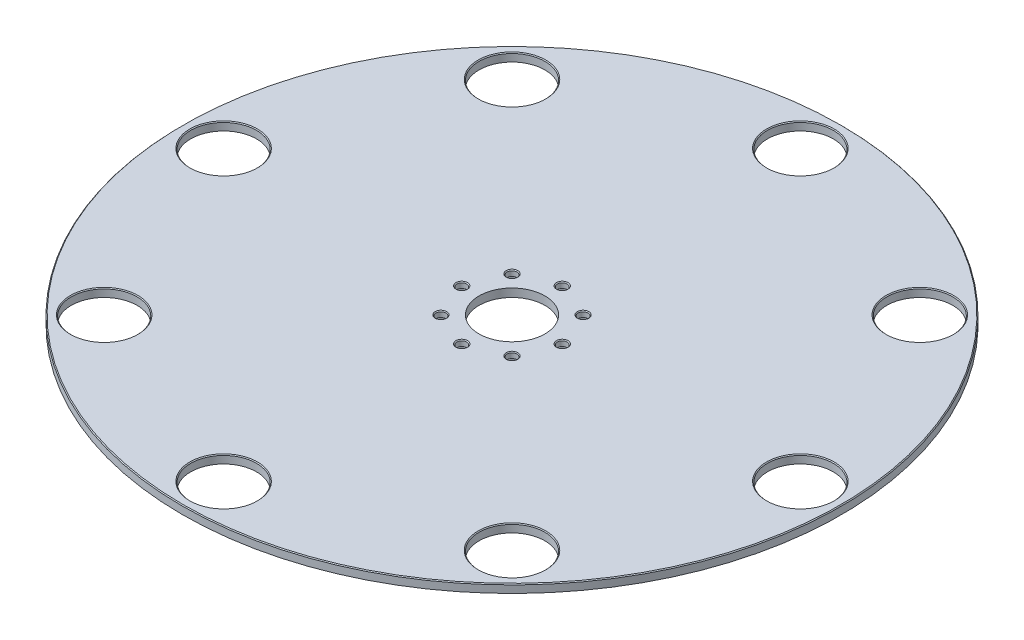
from build123d import *

# Parameters (mm, degrees)
SKETCH2_R            = 400
SKETCH2_R_2          = 40
BOSS_EXTRUDE10_DEPTH = 10
CHAMFER1_SIZE        = 1
SKETCH13_R           = 6
CUT_EXTRUDE1_DEPTH   = 7
CHAMFER2_SIZE        = 1
SKETCH14_R           = 4
CUT_EXTRUDE2_DEPTH   = 3


with BuildPart() as part:
    # Sketch2 → Boss-Extrude10 (new body)
    with BuildSketch(Plane(origin=(0, 0, 0), x_dir=(1, 0, 0), z_dir=(0, 1, 0))):
        Circle(SKETCH2_R)
        Circle(SKETCH2_R_2, mode=Mode.SUBTRACT)
        with Locations((0, 350)):
            Circle(SKETCH2_R_2, mode=Mode.SUBTRACT)
        with Locations((247.487373415, 247.487373415)):
            Circle(SKETCH2_R_2, mode=Mode.SUBTRACT)
        with Locations((350, 0)):
            Circle(SKETCH2_R_2, mode=Mode.SUBTRACT)
        with Locations((247.487373415, -247.487373415)):
            Circle(SKETCH2_R_2, mode=Mode.SUBTRACT)
        with Locations((0, -350)):
            Circle(SKETCH2_R_2, mode=Mode.SUBTRACT)
        with Locations((-247.487373415, -247.487373415)):
            Circle(SKETCH2_R_2, mode=Mode.SUBTRACT)
        with Locations((-350, 0)):
            Circle(SKETCH2_R_2, mode=Mode.SUBTRACT)
        with Locations((-247.487373415, 247.487373415)):
            Circle(SKETCH2_R_2, mode=Mode.SUBTRACT)
    extrude(amount=BOSS_EXTRUDE10_DEPTH)

    # Chamfer1
    chamfer1_edges = [part.edges().sort_by_distance(p)[0] for p in [
        (-287.487373415, 10, 247.487373415),
        (-40, 10, 350),
        (207.487373415, 10, 247.487373415),
        (310, 10, 0),
        (207.487373415, 10, -247.487373415),
        (-40, 10, -350),
        (-287.487373415, 10, -247.487373415),
        (-390, 10, 0),
        (-400, 10, 0),
    ]]
    chamfer(chamfer1_edges, length=CHAMFER1_SIZE)

    # Sketch13 → Cut-Extrude1 (cut)
    with BuildSketch(Plane(origin=(0, 10, 0), x_dir=(1, 0, 0), z_dir=(0, 1, 0))):
        with Locations((-61, 0)):
            Circle(SKETCH13_R)
        with Locations((-43.133513652, 43.133513652)):
            Circle(SKETCH13_R)
        with Locations((0, 61)):
            Circle(SKETCH13_R)
        with Locations((43.133513652, 43.133513652)):
            Circle(SKETCH13_R)
        with Locations((61, 0)):
            Circle(SKETCH13_R)
        with Locations((43.133513652, -43.133513652)):
            Circle(SKETCH13_R)
        with Locations((0, -61)):
            Circle(SKETCH13_R)
        with Locations((-43.133513652, -43.133513652)):
            Circle(SKETCH13_R)
    extrude(amount=-CUT_EXTRUDE1_DEPTH, mode=Mode.SUBTRACT)

    # Chamfer2
    chamfer2_edges = [part.edges().sort_by_distance(p)[0] for p in [
        (-6, 10, 61),
        (37.133513652, 10, 43.133513652),
        (55, 10, 0),
        (37.133513652, 10, -43.133513652),
        (-6, 10, -61),
        (-49.133513652, 10, -43.133513652),
        (-67, 10, 0),
        (-49.133513652, 10, 43.133513652),
    ]]
    chamfer(chamfer2_edges, length=CHAMFER2_SIZE)

    # Sketch14 → Cut-Extrude2 (cut)
    with BuildSketch(Plane.XZ):
        with Locations((-61, 0)):
            Circle(SKETCH14_R)
        with Locations((-43.133513652, 43.133513652)):
            Circle(SKETCH14_R)
        with Locations((0, 61)):
            Circle(SKETCH14_R)
        with Locations((43.133513652, 43.133513652)):
            Circle(SKETCH14_R)
        with Locations((61, 0)):
            Circle(SKETCH14_R)
        with Locations((43.133513652, -43.133513652)):
            Circle(SKETCH14_R)
        with Locations((0, -61)):
            Circle(SKETCH14_R)
        with Locations((-43.133513652, -43.133513652)):
            Circle(SKETCH14_R)
    extrude(amount=-CUT_EXTRUDE2_DEPTH, mode=Mode.SUBTRACT)


solid = part.part
